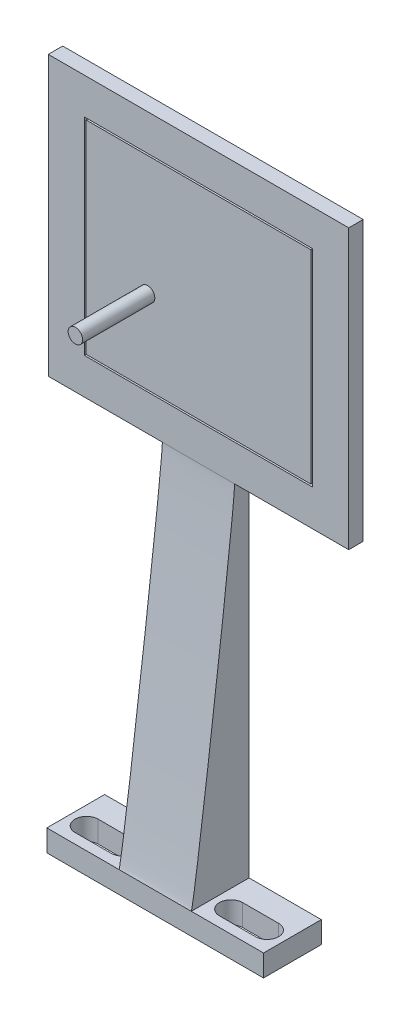
from build123d import *

# Parameters (mm, degrees)
SKETCH1_W            = 31.1
SKETCH1_H            = 28.1
BOSS_EXTRUDE2_DEPTH  = 1.5
SKETCH3_R            = 1
BOSS_EXTRUDE3_DEPTH  = 10
SKETCH4_W            = 41.6
SKETCH4_H            = 38.6
SKETCH4_W_2          = 31.6
SKETCH4_H_2          = 28.6
BOSS_EXTRUDE4_DEPTH  = 2
SKETCH6_W            = 10
SKETCH6_H            = 2
BOSS_EXTRUDE5_DEPTH  = 48.25
SKETCH7_W            = 10
SKETCH7_H            = 3
SKETCH7_H_2          = 2
BOSS_EXTRUDE10_DEPTH = 3
FILLET5_START        = 10.55
FILLET5_DEPTH        = 10


with BuildPart() as part:
    # Sketch1 → Boss-Extrude2 (new body)
    with BuildSketch(Plane.XY):
        with Locations((15.55, -14.05)):
            Rectangle(SKETCH1_W, SKETCH1_H)
    extrude(amount=BOSS_EXTRUDE2_DEPTH)

    # Sketch3 → Boss-Extrude3 (add)
    with BuildSketch(Plane.XY.offset(1.5)):
        with Locations((8.5, -16.6)):
            Circle(SKETCH3_R)
    extrude(amount=BOSS_EXTRUDE3_DEPTH)


with BuildPart() as body_2:
    # Sketch4 → Boss-Extrude4 (new body)
    with BuildSketch(Plane.XY.offset(1.5)):
        with Locations((15.55, -14.05)):
            Rectangle(SKETCH4_W, SKETCH4_H)
        with Locations((15.55, -14.05)):
            Rectangle(SKETCH4_W_2, SKETCH4_H_2, mode=Mode.SUBTRACT)
    extrude(amount=-BOSS_EXTRUDE4_DEPTH)

    # Sketch6 → Boss-Extrude5 (add)
    with BuildSketch(Plane.XZ.offset(33.35)):
        with Locations((15.55, 0.5)):
            Rectangle(SKETCH6_W, SKETCH6_H)
    extrude(amount=BOSS_EXTRUDE5_DEPTH)

    # Sketch7 → Boss-Extrude10 (add)
    with BuildSketch(Plane.XZ.offset(81.6)):
        with BuildLine():
            Line((9.65, 4.5), (10.55, 4.5))
            Line((10.55, 4.5), (10.55, 7.5))
            Line((10.55, 7.5), (0.55, 7.5))
            Line((0.55, 7.5), (0.55, 4.5))
            Line((0.55, 4.5), (1.45, 4.5))
            ThreePointArc((1.45, 4.5), (1.91862917, 5.63137087), (3.050000057, 6.1))
            Line((3.050000057, 6.1), (8.05, 6.1))
            ThreePointArc((8.05, 6.1), (9.18137085, 5.63137085), (9.65, 4.5))
        make_face()
        with BuildLine():
            Line((0.55, 1.5), (10.55, 1.5))
            Line((10.55, 1.5), (10.55, 4.5))
            Line((10.55, 4.5), (9.65, 4.5))
            ThreePointArc((9.65, 4.5), (9.18137085, 3.36862915), (8.05, 2.9))
            Line((8.05, 2.9), (3.05, 2.9))
            ThreePointArc((3.05, 2.9), (1.91862915, 3.36862915), (1.45, 4.5))
            Line((1.45, 4.5), (0.55, 4.5))
            Line((0.55, 4.5), (0.55, 1.5))
        make_face()
        with Locations((15.55, 6)):
            Rectangle(SKETCH7_W, SKETCH7_H)
        with Locations((15.55, 3)):
            Rectangle(SKETCH7_W, SKETCH7_H)
        with BuildLine():
            Line((20.55, 4.5), (20.55, 1.5))
            Line((20.55, 1.5), (30.55, 1.5))
            Line((30.55, 1.5), (30.55, 4.5))
            Line((30.55, 4.5), (29.65, 4.5))
            ThreePointArc((29.65, 4.5), (29.18137085, 3.36862915), (28.05, 2.9))
            Line((28.05, 2.9), (23.05, 2.9))
            ThreePointArc((23.05, 2.9), (21.91862915, 3.36862915), (21.45, 4.5))
            Line((21.45, 4.5), (20.55, 4.5))
        make_face()
        with BuildLine():
            Line((20.55, 7.5), (20.55, 4.5))
            Line((20.55, 4.5), (21.45, 4.5))
            ThreePointArc((21.45, 4.5), (21.91862915, 5.63137085), (23.05, 6.1))
            Line((23.05, 6.1), (28.05, 6.1))
            ThreePointArc((28.05, 6.1), (29.18137085, 5.63137085), (29.65, 4.5))
            Line((29.65, 4.5), (30.55, 4.5))
            Line((30.55, 4.5), (30.55, 7.5))
            Line((30.55, 7.5), (20.55, 7.5))
        make_face()
        with Locations((25.55, 0.5)):
            Rectangle(SKETCH7_W, SKETCH7_H_2)
        with Locations((15.55, 0.5)):
            Rectangle(SKETCH7_W, SKETCH7_H_2)
        with Locations((5.55, 0.5)):
            Rectangle(SKETCH7_W, SKETCH7_H_2)
    extrude(amount=BOSS_EXTRUDE10_DEPTH)

    # Fillet5: read off the stored shape, not the designer's step
    # Fillet5 outline → Fillet5 (add)
    with BuildSketch(Plane.YZ.offset(FILLET5_START)):
        with BuildLine():
            add(Edge.make_bspline(
                [(-81.6, 7.5), (-81.6, 1.5), (-33.35, 1.5)],
                knots=[0, 0, 0, 1, 1, 1], degree=2, weights=[1, 0.052631579, 1]))
            Line((-81.6, 7.5), (-81.6, 1.5))
            Line((-81.6, 1.5), (-33.35, 1.5))
        make_face()
    extrude(amount=FILLET5_DEPTH)


solid = Compound([part.part, body_2.part])
